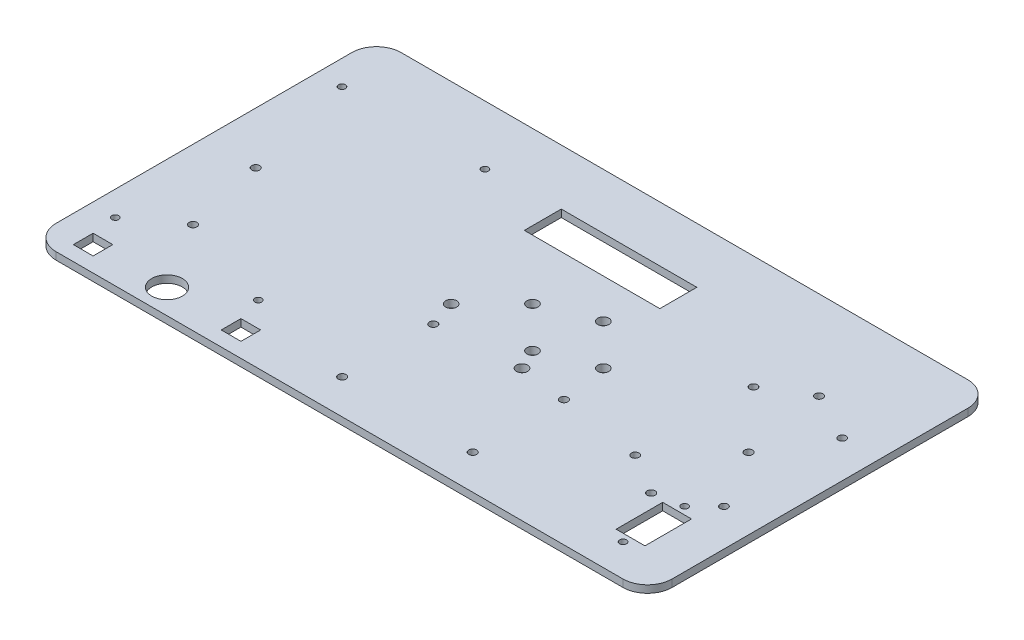
from build123d import *

# Parameters (mm, degrees)
SKETCH1_W               = 250
SKETCH1_H               = 140
BOSS_EXTRUDE1_DEPTH     = 3
FILLET2_R               = 10
CUT_EXTRUDE5_DEPTH      = 7
CUT_EXTRUDE5_DEPTH_BACK = 7
SKETCH2_R               = 1.55
SKETCH2_R_2             = 1.6
SKETCH2_R_3             = 2.25
SKETCH2_R_4             = 1.4
CUT_EXTRUDE6_DEPTH      = 7
CUT_EXTRUDE6_DEPTH_BACK = 7
SKETCH3_R               = 1.6
CUT_EXTRUDE7_DEPTH      = 7
CUT_EXTRUDE7_DEPTH_BACK = 7
SKETCH4_R               = 1.6
CUT_EXTRUDE8_DEPTH      = 7
CUT_EXTRUDE8_DEPTH_BACK = 7
SKETCH5_R               = 1.4
SKETCH5_W               = 11.7
SKETCH5_H               = 18.9
SKETCH5_W_2             = 8
SKETCH5_H_2             = 8
SKETCH5_R_2             = 6.2


with BuildPart() as part:
    # Sketch1 → Boss-Extrude1 (new body)
    with BuildSketch(Plane(origin=(0, 0, 0), x_dir=(1, 0, 0), z_dir=(0, 1, 0))):
        Rectangle(SKETCH1_W, SKETCH1_H)
    extrude(amount=BOSS_EXTRUDE1_DEPTH)

    # Fillet2
    fillet2_edges = [part.edges().sort_by_distance(p)[0] for p in [
        (-125, 1.5, 70),
        (125, 1.5, 70),
        (-125, 1.5, -70),
        (125, 1.5, -70),
    ]]
    fillet(fillet2_edges, radius=FILLET2_R)

    # Sketch2 → Cut-Extrude5 (cut, two sides: drawn at the far end of the back side and taken through both)
    with BuildSketch(Plane(origin=(0, 0, 0), x_dir=(1, 0, 0), z_dir=(0, 1, 0)).offset(-CUT_EXTRUDE5_DEPTH_BACK)):
        with Locations((110, 24)):
            Circle(SKETCH2_R)
        with Locations((74, 24)):
            Circle(SKETCH2_R)
        with Locations((74, -24)):
            Circle(SKETCH2_R)
        with Locations((110, -24)):
            Circle(SKETCH2_R)
        with Locations((-13, -18.939424071)):
            Circle(SKETCH2_R_2)
        with Locations((-13, -55.939424071)):
            Circle(SKETCH2_R_2)
        with Locations((40, -18.939424071)):
            Circle(SKETCH2_R_2)
        with Locations((40, -55.939424071)):
            Circle(SKETCH2_R_2)
        with Locations((37, 0.060575929)):
            Circle(SKETCH2_R_3)
        with Locations((20.5, 16.560575929)):
            Circle(SKETCH2_R_3)
        with Locations((20.5, -16.439424071)):
            Circle(SKETCH2_R_3)
        with Locations((96, 0)):
            Circle(SKETCH2_R_2)
        with Locations((-104, 0)):
            Circle(SKETCH2_R_2)
        with Locations((-115, 46)):
            Circle(SKETCH2_R_4)
        with Locations((-57, 46)):
            Circle(SKETCH2_R_4)
        with Locations((-57, -46)):
            Circle(SKETCH2_R_4)
        with Locations((-115, -46)):
            Circle(SKETCH2_R_4)
        with Locations((-16.5, -8.189424071)):
            Circle(SKETCH2_R_3)
        with Locations((16.5, -8.189424071)):
            Circle(SKETCH2_R_3)
        with Locations((0, 8.310575929)):
            Circle(SKETCH2_R_3)
    extrude(amount=CUT_EXTRUDE5_DEPTH + CUT_EXTRUDE5_DEPTH_BACK, mode=Mode.SUBTRACT)

    # Sketch3 → Cut-Extrude6 (cut, two sides: drawn at the far end of the back side and taken through both)
    with BuildSketch(Plane(origin=(0, 0, 0), x_dir=(1, 0, 0), z_dir=(0, 1, 0)).offset(-CUT_EXTRUDE6_DEPTH_BACK)):
        with Locations((-96.745, -32.704968659)):
            Circle(SKETCH3_R)
    extrude(amount=CUT_EXTRUDE6_DEPTH + CUT_EXTRUDE6_DEPTH_BACK, mode=Mode.SUBTRACT)

    # Sketch4 → Cut-Extrude7 (cut, two sides: drawn at the far end of the back side and taken through both)
    with BuildSketch(Plane(origin=(0, 3, 0), x_dir=(1, 0, 0), z_dir=(0, 1, 0)).offset(-CUT_EXTRUDE7_DEPTH_BACK)):
        with Locations((90.54, -34.065208057)):
            Circle(SKETCH4_R)
        with Locations((90.54, 34.065208057)):
            Circle(SKETCH4_R)
    extrude(amount=CUT_EXTRUDE7_DEPTH + CUT_EXTRUDE7_DEPTH_BACK, mode=Mode.SUBTRACT)

    # Sketch5 → Cut-Extrude8 (cut, two sides: drawn at the far end of the back side and taken through both)
    with BuildSketch(Plane(origin=(0, 3, 0), x_dir=(1, 0, 0), z_dir=(0, 1, 0)).offset(-CUT_EXTRUDE8_DEPTH_BACK)):
        with Locations((102, -31.945997938)):
            Circle(SKETCH5_R)
        with Locations((102, -44.445997938)):
            Rectangle(SKETCH5_W, SKETCH5_H)
        with Locations((102, -56.945997938)):
            Circle(SKETCH5_R)
        with Locations((-110, -60)):
            Rectangle(SKETCH5_W_2, SKETCH5_H_2)
        Polygon((-54, -56), (-54, -60), (-54, -64), (-46, -64), (-46, -56), align=None)
        with Locations((-80, -60)):
            Circle(SKETCH5_R_2)
        Polygon((0, 47.5), (-27.5, 47.5), (-27.5, 32.5), (27.5, 32.5), (27.5, 47.5), align=None)
    extrude(amount=CUT_EXTRUDE8_DEPTH + CUT_EXTRUDE8_DEPTH_BACK, mode=Mode.SUBTRACT)


solid = part.part
